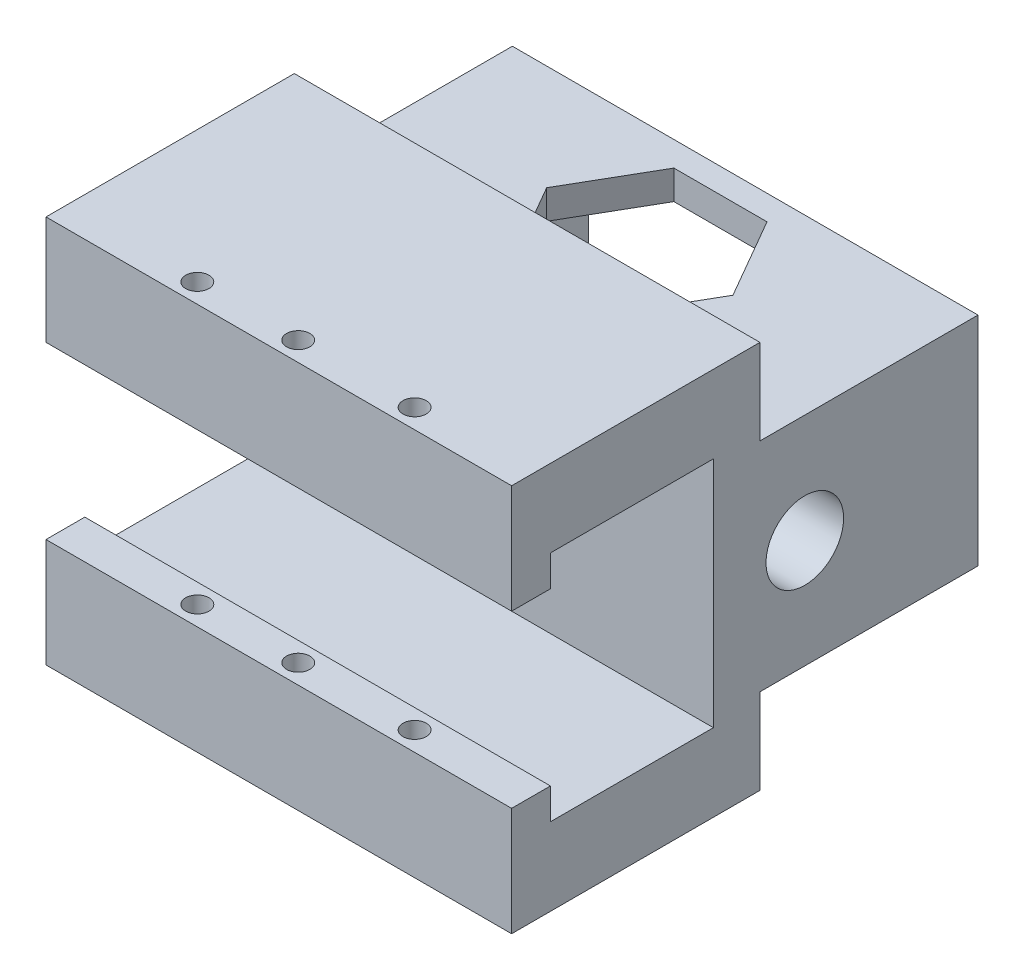
from build123d import *

# Parameters (mm, degrees)
SKETCH_1_W          = 60
SKETCH_1_H          = 50
EXTRUDE_1_DEPTH     = 6
SKETCH_2_W          = 60
SKETCH_2_H          = 10
EXTRUDE_3_DEPTH     = 26
SKETCH_3_W          = 60
SKETCH_3_H          = 5
EXTRUDE_4_DEPTH     = 4
SKETCH_4_W          = 60
SKETCH_4_H          = 5
EXTRUDE_5_DEPTH     = 4
SKETCH_9_W          = 60
SKETCH_9_H          = 28
SKETCH_9_W_2        = 40.4
SKETCH_9_H_2        = 20.5
EXTRUDE_6_DEPTH     = 28.1
SKETCH_11_R         = 5
CUT_EXTRUDE_3_DEPTH = 10
SKETCH_12_R         = 2.25
CUT_EXTRUDE_4_DEPTH = 16
CUT_EXTRUDE_5_DEPTH = 59.694122363
SKETCH_15_R         = 1.5
CUT_EXTRUDE_6_DEPTH = 57.745043836
SKETCH_16_R         = 1.5
CUT_EXTRUDE_7_DEPTH = 57.745043836


with BuildPart() as part:
    # 草图1 → 凸台-拉伸1 (new body)
    with BuildSketch(Plane.XY):
        Rectangle(SKETCH_1_W, SKETCH_1_H)
    extrude(amount=EXTRUDE_1_DEPTH)

    # 草图2 → 凸台-拉伸3 (add)
    with BuildSketch(Plane.XY.offset(6)):
        with Locations((0, 20)):
            Rectangle(SKETCH_2_W, SKETCH_2_H)
        with Locations((0, -20)):
            Rectangle(SKETCH_2_W, SKETCH_2_H)
    extrude(amount=EXTRUDE_3_DEPTH)

    # 草图3 → 凸台-拉伸4 (add)
    with BuildSketch(Plane(origin=(0, -15, 0), x_dir=(1, 0, 0), z_dir=(0, 1, 0))):
        with Locations((0, -29.5)):
            Rectangle(SKETCH_3_W, SKETCH_3_H)
    extrude(amount=EXTRUDE_4_DEPTH)

    # 草图4 → 凸台-拉伸5 (add)
    with BuildSketch(Plane.XZ.offset(-15)):
        with Locations((0, 29.5)):
            Rectangle(SKETCH_4_W, SKETCH_4_H)
    extrude(amount=EXTRUDE_5_DEPTH)

    # 草图9 → 凸台-拉伸6 (add)
    with BuildSketch(Plane(origin=(0, 0, 0), x_dir=(-1, 0, 0), z_dir=(0, 0, -1))):
        Rectangle(SKETCH_9_W, SKETCH_9_H)
        Rectangle(SKETCH_9_W_2, SKETCH_9_H_2, mode=Mode.SUBTRACT)
    extrude(amount=EXTRUDE_6_DEPTH)

    # 草图11 → 切除-拉伸3 (cut)
    with BuildSketch(Plane(origin=(30, 0, 0), x_dir=(0, 0, -1), z_dir=(1, 0, 0))):
        with Locations((5.781700187, 0)):
            Circle(SKETCH_11_R)
    extrude(amount=-CUT_EXTRUDE_3_DEPTH, mode=Mode.SUBTRACT)

    # 草图12 → 切除-拉伸4 (cut)
    with BuildSketch(Plane(origin=(0, 0, -28.1), x_dir=(-1, 0, 0), z_dir=(0, 0, -1))):
        with Locations((24.8, -5)):
            Circle(SKETCH_12_R)
        with Locations((24.8, 5)):
            Circle(SKETCH_12_R)
        with Locations((-24.8, -5)):
            Circle(SKETCH_12_R)
        with Locations((-24.8, 5)):
            Circle(SKETCH_12_R)
    extrude(amount=-CUT_EXTRUDE_4_DEPTH, mode=Mode.SUBTRACT)

    # 草图13 → 切除-拉伸5 (cut, through all)
    with BuildSketch(Plane(origin=(0, 14, 0), x_dir=(1, 0, 0), z_dir=(0, 1, 0))):
        Polygon((-12, 14.518770095), (-6, 4.12646525), (6, 4.12646525), (12, 14.518770095), (6, 24.911074941), (-6, 24.911074941), align=None)
    extrude(amount=-CUT_EXTRUDE_5_DEPTH, mode=Mode.SUBTRACT)

    # 草图15 → 切除-拉伸6 (cut, through all)
    with BuildSketch(Plane(origin=(0, -11, 0), x_dir=(1, 0, 0), z_dir=(0, 1, 0))):
        with Locations((15, -29.5)):
            Circle(SKETCH_15_R)
        with Locations((0, -29.5)):
            Circle(SKETCH_15_R)
        with Locations((-13, -29.5)):
            Circle(SKETCH_15_R)
    extrude(amount=-CUT_EXTRUDE_6_DEPTH, mode=Mode.SUBTRACT)

    # 草图16 → 切除-拉伸7 (cut, through all)
    with BuildSketch(Plane.XZ.offset(-11)):
        with Locations((-13, 29.5)):
            Circle(SKETCH_16_R)
        with Locations((0, 29.5)):
            Circle(SKETCH_16_R)
        with Locations((15, 29.5)):
            Circle(SKETCH_16_R)
    extrude(amount=-CUT_EXTRUDE_7_DEPTH, mode=Mode.SUBTRACT)


solid = part.part
